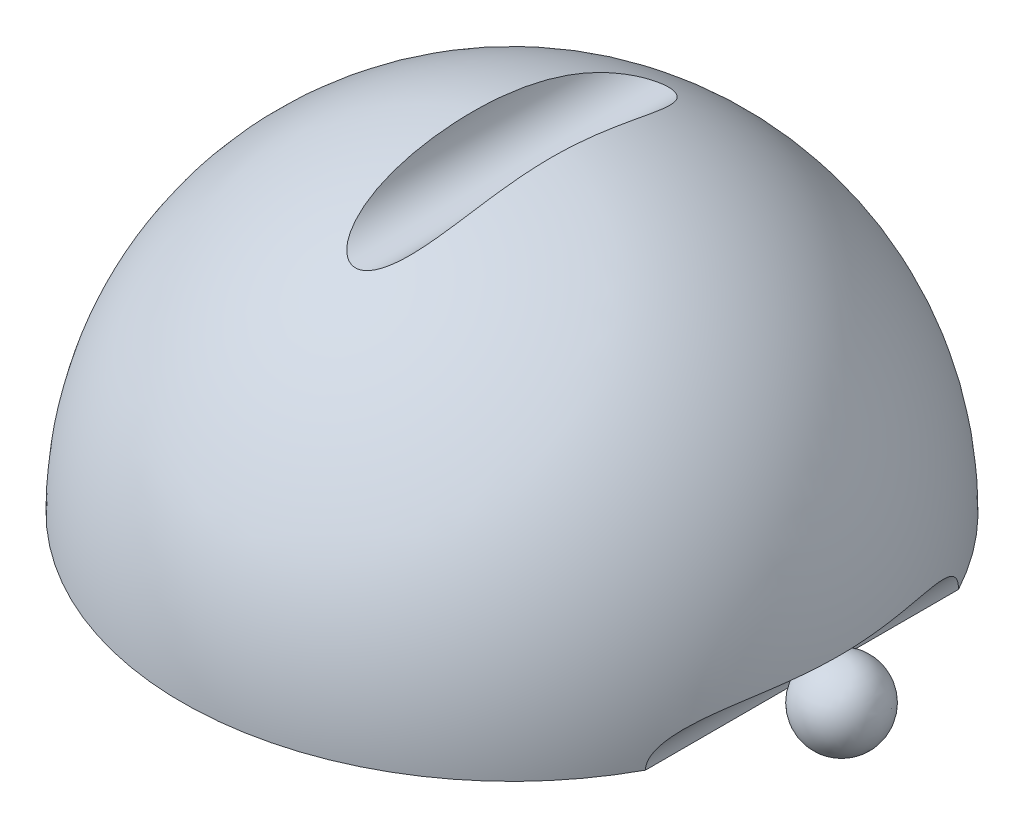
from build123d import *

# Parameters (mm, degrees)
CORTAR_EXTRUIR1_DEPTH      = 15
CORTAR_EXTRUIR1_DEPTH_BACK = 15
CROQUIS4_R                 = 3


# Read off the part's stored shape, not the designer's step: Revolución2
with BuildPart() as part:
    # Revolución2 outline → Revolución2 (revolve)
    with BuildSketch(Plane.XY):
        with BuildLine():
            Line((0, 0), (25, -2.5e-08))
            ThreePointArc((25, -2.5e-08), (17.677669539, 17.677669521), (0, 25))
            Line((0, 25), (0, 0))
        make_face()
    revolve(axis=Axis((0, 0, 0), (0, 1, 0)))

    # Croquis4 → Cortar-Extruir1 (cut, two sides: drawn at the far end of the back side and taken through both)
    with BuildSketch(Plane.XY.offset(-CORTAR_EXTRUIR1_DEPTH_BACK)):
        with Locations((0, 25)):
            Circle(CROQUIS4_R)
        with Locations((25, 0)):
            Circle(CROQUIS4_R)
        with Locations((-25, 0)):
            Circle(CROQUIS4_R)
    extrude(amount=CORTAR_EXTRUIR1_DEPTH + CORTAR_EXTRUIR1_DEPTH_BACK, mode=Mode.SUBTRACT)


with BuildPart() as body_2:
    # Croquis10 → Revolución4 (revolve)
    with BuildSketch(Plane.XY):
        with BuildLine():
            Line((25, -3), (25, 3))
            ThreePointArc((25, 3), (28, 0), (25, -3))
        make_face()
    revolve(axis=Axis((25, -3, 0), (0, 1, 0)))


with BuildPart() as body_3:
    # Croquis11 → Revolución5 (revolve)
    with BuildSketch(Plane.XY):
        with BuildLine():
            Line((-25, -3), (-25, 3))
            ThreePointArc((-25, 3), (-28, 0), (-25, -3))
        make_face()
    revolve(axis=Axis((-25, -3, 0), (0, 1, 0)))


solid = Compound([part.part, body_2.part, body_3.part])
